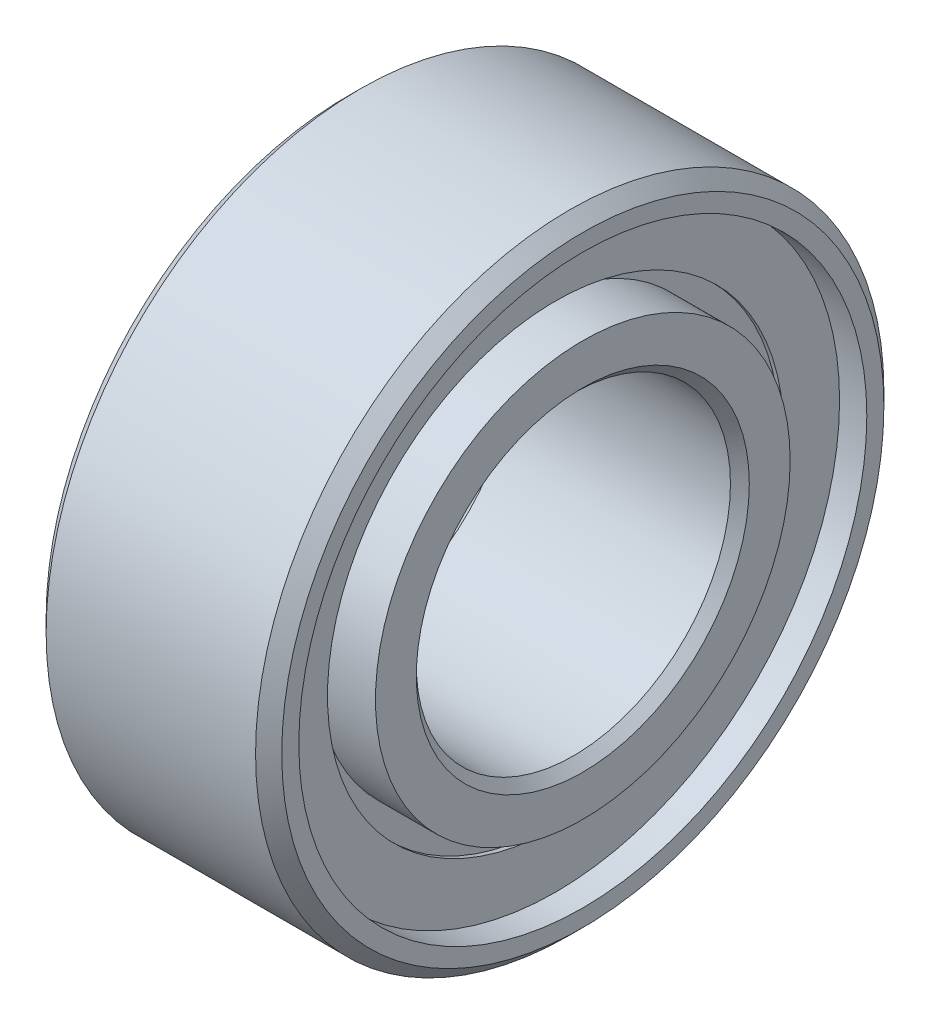
from build123d import *


with BuildPart() as part:
    # Sketch1 → Revolve1 (revolve)
    with BuildSketch(Plane.XY):
        Polygon((-2.38125, 3.3655), (-2.19075, 3.175), (2.19075, 3.175), (2.38125, 3.3655), (2.38125, 4.191), (1.190625, 4.191), (1.190625, 5.7404), (1.741289063, 5.7404), (1.741289063, 4.6101), (1.830585938, 4.6101), (1.830585938, 5.7404), (2.38125, 5.7404), (2.38125, 6.085416667), (2.116666667, 6.35), (-2.116666667, 6.35), (-2.38125, 6.085416667), (-2.38125, 5.7404), (-1.830585937, 5.7404), (-1.830585937, 4.6101), (-1.741289062, 4.6101), (-1.741289062, 5.7404), (-1.190625, 5.7404), (-1.190625, 4.191), (-2.38125, 4.191), align=None)
    revolve(axis=Axis((-2.38125, 0, 0), (1, 0, 0)))


solid = part.part
